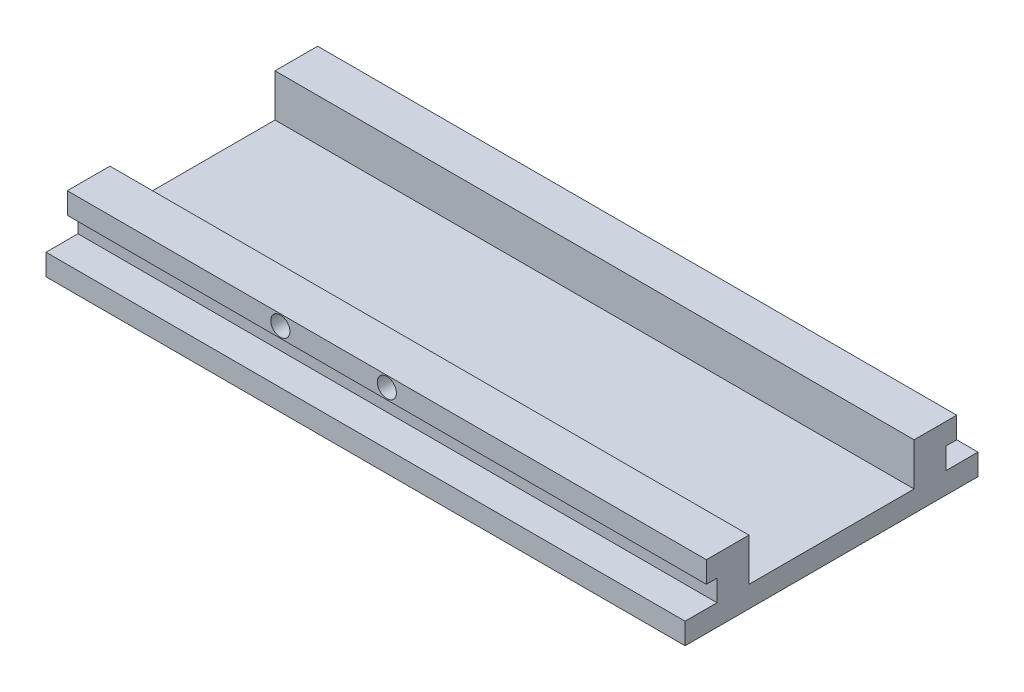
from build123d import *

# Parameters (mm, degrees)
SKETCH1_W               = 76.2
SKETCH1_H               = 34.925
BOSS_EXTRUDE1_DEPTH     = 2.54
SKETCH3_W               = 76.2
SKETCH3_H               = 3.81
BOSS_EXTRUDE3_DEPTH     = 5.08
SKETCH6_W               = 76.2
SKETCH6_H               = 2.54
BOSS_EXTRUDE4_DEPTH     = 1.27
SKETCH7_W               = 76.2
SKETCH7_H               = 2.54
BOSS_EXTRUDE5_DEPTH     = 1.27
FILL_START              = -15.231570796
FILL_PATTERN1_OUTLINE_R = 1.143
FILL_PATTERN1_DEPTH     = 29.845
SKETCH8_W               = 76.2
SKETCH8_H               = 2.54
BOSS_EXTRUDE6_DEPTH     = 1.27
SKETCH9_W               = 76.2
SKETCH9_H               = 2.54
BOSS_EXTRUDE7_DEPTH     = 1.27


# Read off the part's stored shape, not the designer's step: Fill Pattern1
with BuildPart() as part:
    # Sketch1 → Boss-Extrude1 (new body)
    with BuildSketch(Plane(origin=(0, 0, 0), x_dir=(1, 0, 0), z_dir=(0, 1, 0))):
        with Locations((1.784181416, 0.309070796)):
            Rectangle(SKETCH1_W, SKETCH1_H)
    extrude(amount=BOSS_EXTRUDE1_DEPTH)

    # Sketch3 → Boss-Extrude3 (add)
    with BuildSketch(Plane(origin=(0, 2.54, 0), x_dir=(1, 0, 0), z_dir=(0, 1, 0))):
        with Locations((1.784181416, 12.056570796)):
            Rectangle(SKETCH3_W, SKETCH3_H)
        with Locations((1.784181416, -11.438429204)):
            Rectangle(SKETCH3_W, SKETCH3_H)
    extrude(amount=BOSS_EXTRUDE3_DEPTH)

    # Sketch6 → Boss-Extrude4 (add)
    with BuildSketch(Plane.XY.offset(13.343429204)):
        with Locations((1.784181416, 6.35)):
            Rectangle(SKETCH6_W, SKETCH6_H)
    extrude(amount=BOSS_EXTRUDE4_DEPTH)

    # Sketch7 → Boss-Extrude5 (add)
    with BuildSketch(Plane(origin=(0, 0, -13.961570796), x_dir=(-1, 0, 0), z_dir=(0, 0, -1))):
        with Locations((-1.784181416, 6.35)):
            Rectangle(SKETCH7_W, SKETCH7_H)
    extrude(amount=BOSS_EXTRUDE5_DEPTH)

    # Fill Pattern1 outline → Fill Pattern1 (cut)
    with BuildSketch(Plane.XY.offset(FILL_START)):
        with Locations((1.784181416, 6.35)):
            Circle(FILL_PATTERN1_OUTLINE_R)
        with Locations((-10.915818584, 6.35)):
            Circle(FILL_PATTERN1_OUTLINE_R)
    extrude(amount=FILL_PATTERN1_DEPTH, mode=Mode.SUBTRACT)

    # Sketch8 → Boss-Extrude6 (add)
    with BuildSketch(Plane(origin=(0, 0, 9.533429204), x_dir=(-1, 0, 0), z_dir=(0, 0, -1))):
        with Locations((-1.784181416, 6.35)):
            Rectangle(SKETCH8_W, SKETCH8_H)
    extrude(amount=-BOSS_EXTRUDE6_DEPTH)

    # Sketch9 → Boss-Extrude7 (add)
    with BuildSketch(Plane.XY.offset(-10.151570796)):
        with Locations((1.784181416, 6.35)):
            Rectangle(SKETCH9_W, SKETCH9_H)
    extrude(amount=-BOSS_EXTRUDE7_DEPTH)


solid = part.part
